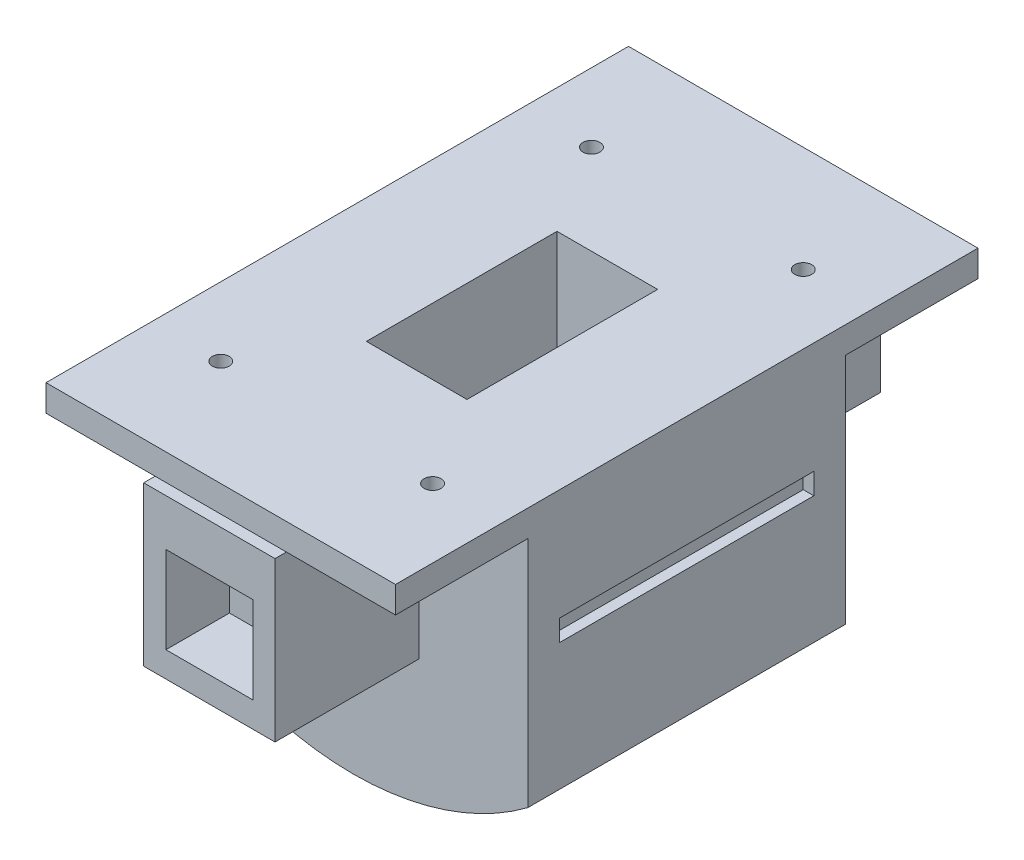
from build123d import *

# Parameters (mm, degrees)
BOSS_EXTRUDE1_DEPTH      = 30
BOSS_EXTRUDE1_DEPTH_BACK = 30
CUT_EXTRUDE1_DEPTH       = 18
CUT_EXTRUDE1_DEPTH_BACK  = 18
SKETCH2_W                = 19
SKETCH2_H                = 52
SKETCH3_W                = 21.854352608
SKETCH3_H                = 45
CUT_EXTRUDE2_DEPTH       = 99.234413522
SKETCH4_R                = 1.6
CUT_EXTRUDE3_DEPTH       = 84.366660003
SKETCH6_W                = 48
SKETCH6_H                = 4
CUT_EXTRUDE5_DEPTH       = 2
SKETCH9_W                = 22
SKETCH9_H                = 60
CUT_EXTRUDE7_DEPTH       = 84.366660003
SKETCH10_W               = 66
SKETCH10_H               = 110
SKETCH10_W_2             = 19
SKETCH10_H_2             = 36
BOSS_EXTRUDE2_DEPTH      = 5
SKETCH11_R               = 1.6
CUT_EXTRUDE8_DEPTH       = 88.82938005
SKETCH13_W               = 24.8
SKETCH13_H               = 30
BOSS_EXTRUDE3_DEPTH      = 27.15
SKETCH14_W               = 16.4
SKETCH14_H               = 16.4
CUT_EXTRUDE9_DEPTH       = 12


with BuildPart() as part:
    # Sketch1 → Boss-Extrude1 (new, two sides: drawn at the far end of the back side and taken through both)
    with BuildSketch(Plane.XY.offset(-BOSS_EXTRUDE1_DEPTH_BACK)):
        with BuildLine():
            Line((55, 0), (0, 0))
            Line((0, 0), (-55, 0))
            ThreePointArc((-55, 0), (0, -55), (55, 0))
        make_face()
    extrude(amount=BOSS_EXTRUDE1_DEPTH + BOSS_EXTRUDE1_DEPTH_BACK)

    # Sketch2 → Cut-Extrude1 (cut, two sides: drawn at the far end of the back side and taken through both)
    with BuildSketch(Plane.XY.offset(-CUT_EXTRUDE1_DEPTH_BACK)):
        with Locations((0, -26)):
            Rectangle(SKETCH2_W, SKETCH2_H)
    extrude(amount=CUT_EXTRUDE1_DEPTH + CUT_EXTRUDE1_DEPTH_BACK, mode=Mode.SUBTRACT)

    # Sketch3 → Cut-Extrude2 (cut, through all)
    with BuildSketch(Plane.XY.offset(30)):
        with Locations((-43.927176304, -26.5)):
            Rectangle(SKETCH3_W, SKETCH3_H)
        with Locations((43.927176304, -26.5)):
            Rectangle(SKETCH3_W, SKETCH3_H)
    extrude(amount=-CUT_EXTRUDE2_DEPTH, mode=Mode.SUBTRACT)

    # Sketch4 → Cut-Extrude3 (cut, through all)
    with BuildSketch(Plane(origin=(0, 0, 0), x_dir=(1, 0, 0), z_dir=(0, 1, 0))):
        with Locations((45, 20)):
            Circle(SKETCH4_R)
        with Locations((45, -20)):
            Circle(SKETCH4_R)
        with Locations((-45, -20)):
            Circle(SKETCH4_R)
        with Locations((-45, 20)):
            Circle(SKETCH4_R)
    extrude(amount=-CUT_EXTRUDE3_DEPTH, mode=Mode.SUBTRACT)

    # Sketch6 → Cut-Extrude5 (cut)
    with BuildSketch(Plane(origin=(33, 0, 0), x_dir=(0, 0, -1), z_dir=(1, 0, 0))):
        with Locations((0, -18)):
            Rectangle(SKETCH6_W, SKETCH6_H)
    extrude(amount=-CUT_EXTRUDE5_DEPTH, mode=Mode.SUBTRACT)

    # Sketch9 → Cut-Extrude7 (cut, through all)
    with BuildSketch(Plane(origin=(0, 0, 0), x_dir=(1, 0, 0), z_dir=(0, 1, 0))):
        with Locations((-44, 0)):
            Rectangle(SKETCH9_W, SKETCH9_H)
        with Locations((44, 0)):
            Rectangle(SKETCH9_W, SKETCH9_H)
    extrude(amount=-CUT_EXTRUDE7_DEPTH, mode=Mode.SUBTRACT)

    # Sketch10 → Boss-Extrude2 (add)
    with BuildSketch(Plane(origin=(0, 0, 0), x_dir=(1, 0, 0), z_dir=(0, 1, 0))):
        Rectangle(SKETCH10_W, SKETCH10_H)
        Rectangle(SKETCH10_W_2, SKETCH10_H_2, mode=Mode.SUBTRACT)
    extrude(amount=BOSS_EXTRUDE2_DEPTH)

    # Sketch11 → Cut-Extrude8 (cut, through all)
    with BuildSketch(Plane(origin=(0, 5, 0), x_dir=(1, 0, 0), z_dir=(0, 1, 0))):
        with Locations((-20, 35)):
            Circle(SKETCH11_R)
        with Locations((20, 35)):
            Circle(SKETCH11_R)
        with Locations((-20, -35)):
            Circle(SKETCH11_R)
        with Locations((20, -35)):
            Circle(SKETCH11_R)
    extrude(amount=-CUT_EXTRUDE8_DEPTH, mode=Mode.SUBTRACT)

    # Sketch13 → Boss-Extrude3 (add)
    with BuildSketch(Plane(origin=(0, 0, -30), x_dir=(-1, 0, 0), z_dir=(0, 0, -1))):
        with Locations((0, -15)):
            Rectangle(SKETCH13_W, SKETCH13_H)
    boss_extrude3 = extrude(amount=BOSS_EXTRUDE3_DEPTH)

    # Sketch14 → Cut-Extrude9 (cut)
    with BuildSketch(Plane(origin=(0, 0, -57.15), x_dir=(-1, 0, 0), z_dir=(0, 0, -1))):
        with Locations((0, -17)):
            Rectangle(SKETCH14_W, SKETCH14_H)
    cut_extrude9 = extrude(amount=-CUT_EXTRUDE9_DEPTH, mode=Mode.SUBTRACT)

    # Mirror2: Boss-Extrude3 across plane
    add(boss_extrude3.mirror(Plane(origin=(0, 0, 0), x_dir=(1, 0, 0), z_dir=(0, 0, -1))))

    # Mirror3: Cut-Extrude9 across plane
    add(cut_extrude9.mirror(Plane(origin=(0, 0, 0), x_dir=(1, 0, 0), z_dir=(0, 0, -1))), mode=Mode.SUBTRACT)


solid = part.part
